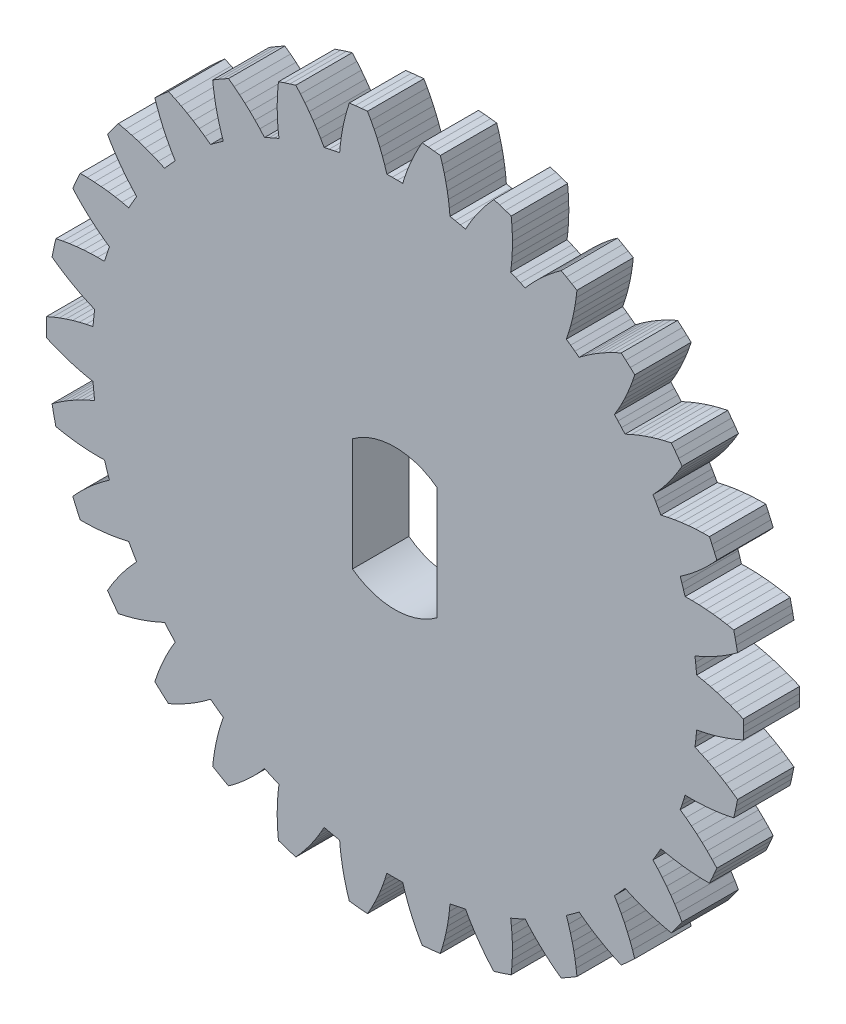
from build123d import *

# Parameters (mm, degrees)
BOSS_EXTRUDE1_DEPTH = 2
CUT_EXTRUDE1_REACH  = 33.235


with BuildPart() as part:
    # Sketch2 → Boss-Extrude1 (new body)
    with BuildSketch(Plane.XY):
        Polygon((0.281141132, 27.022846222), (0.355339468, 27.259799957), (0.437802315, 27.494007111), (0.528428257, 27.725175858), (0.627105772, 27.953025818), (0.733713448, 28.177274704), (0.848120153, 28.39764595), (0.970185101, 28.613870621), (1.185179591, 28.595060349), (1.399813175, 28.572502136), (1.614020228, 28.546201706), (1.688462257, 28.309322357), (1.754551053, 28.069980621), (1.812205195, 27.828466415), (1.861353755, 27.5850811), (1.901936412, 27.340120316), (1.933902979, 27.093887329), (1.957214355, 26.846683502), (2.141216993, 26.810916901), (2.324567318, 26.771945953), (2.507209539, 26.72977829), (2.629051915, 26.946127316), (2.758407156, 27.158071491), (2.895115389, 27.365346454), (3.039009235, 27.567701136), (3.189911242, 27.764884664), (3.347635644, 27.956653779), (3.511988817, 28.142774692), (3.718374287, 28.079675601), (3.923627496, 28.012985508), (4.127685444, 27.942723655), (4.15125075, 27.69554332), (4.166133402, 27.447691142), (4.172314036, 27.199467631), (4.169785929, 26.951182309), (4.158551547, 26.703136896), (4.138624851, 26.455638468), (4.110030253, 26.20898993), (4.282575697, 26.135748615), (4.453816861, 26.059508601), (4.623700762, 25.980288949), (4.787862081, 26.166577775), (4.958456272, 26.346995995), (5.135271989, 26.521318262), (5.318093314, 26.689333797), (5.506694511, 26.8508341), (5.700843297, 27.005619852), (5.900301673, 27.15350263), (6.089058086, 27.048872454), (6.27596037, 26.940965159), (6.460950902, 26.829812662), (6.432609568, 26.583134308), (6.395635633, 26.337604018), (6.350072635, 26.09351976), (6.295978353, 25.851185691), (6.233417927, 25.610896425), (6.162468861, 25.372949424), (6.083218008, 25.1376359), (6.236765195, 25.030120868), (6.388413139, 24.919943841), (6.538113977, 24.807134479), (6.737419602, 24.955221391), (6.941796958, 25.096228513), (7.150992465, 25.229979365), (7.364751099, 25.356312667), (7.582808708, 25.475071407), (7.804896645, 25.586108917), (8.030742935, 25.689290373), (8.193620731, 25.547701953), (8.354003563, 25.40329352), (8.511841705, 25.256108278), (8.432832383, 25.020712933), (8.3456178, 24.788235382), (8.250302492, 24.55895803), (8.147006213, 24.333166376), (8.035853936, 24.11113505), (7.916983314, 23.893138903), (7.79053985, 23.679444723), (7.91837803, 23.542354897), (8.04380501, 23.403056122), (8.16678014, 23.261587361), (8.39251946, 23.365000249), (8.621747709, 23.460433585), (8.854180158, 23.547767469), (9.089533824, 23.626897166), (9.327517681, 23.697724017), (9.567838461, 23.760160412), (9.810202098, 23.814131022), (9.940082735, 23.64177245), (10.066936617, 23.467174223), (10.190724084, 23.290388937), (10.064499861, 23.076564506), (9.930856325, 22.867300078), (9.789954444, 22.662850154), (9.641970712, 22.463469093), (9.48708447, 22.269399543), (9.325487508, 22.080881726), (9.157377619, 21.898146351), (9.253919651, 21.737473215), (9.347643907, 21.575140716), (9.438518726, 21.41119542), (9.680825848, 21.465414644), (9.924886617, 21.5111033), (10.170397595, 21.548203306), (10.417060207, 21.576671051), (10.664569277, 21.596470538), (10.912619727, 21.607577049), (11.160908258, 21.609978038), (11.25211533, 21.414382212), (11.339896137, 21.217224969), (11.424222823, 21.018566005), (11.256300304, 20.835657642), (11.082068678, 20.658752198), (10.901738311, 20.488065143), (10.715534726, 20.323808585), (10.523683791, 20.16618258), (10.326423053, 20.015382228), (10.123993948, 19.87159207), (10.185020481, 19.694357811), (10.242945813, 19.516086298), (10.297748656, 19.336829663), (10.546033596, 19.339485583), (10.794260257, 19.333432746), (11.042119756, 19.318677425), (11.289310975, 19.29523904), (11.535527923, 19.263145832), (11.780467049, 19.22243705), (12.023829074, 19.173163484), (12.072376393, 18.962878879), (12.117247684, 18.75177934), (12.158428108, 18.539929046), (11.956146312, 18.395930725), (11.748941355, 18.259115881), (11.537063805, 18.129651539), (11.320778356, 18.007698283), (11.100347536, 17.893404837), (10.876044262, 17.786912648), (10.648143063, 17.688352028), (10.670986946, 17.502302632), (10.690581739, 17.315883426), (10.706917458, 17.129149827), (10.950328974, 17.080126367), (11.19187283, 17.022596574), (11.431248201, 16.956630805), (11.668164585, 16.882310661), (11.902328548, 16.799727384), (12.133451335, 16.708982479), (12.361250766, 16.610187848), (12.365016582, 16.394404912), (12.365017264, 16.178589137), (12.361251645, 15.962806389), (12.133451257, 15.864011527), (11.90232882, 15.773266749), (11.668164153, 15.690683333), (11.431249552, 15.616363322), (11.191872731, 15.550397607), (10.95033005, 15.4928678), (10.706917134, 15.44384429), (10.690579979, 15.257111009), (10.670987846, 15.070691524), (10.648142492, 14.884642115), (10.876042332, 14.786081836), (11.100346759, 14.679589415), (11.320776149, 14.565296217), (11.537063315, 14.443342461), (11.748940205, 14.313878402), (11.956145478, 14.177063361), (12.158426386, 14.033065465), (12.117246114, 13.821214946), (12.07237616, 13.610115123), (12.023829072, 13.399830662), (11.780466062, 13.350557068), (11.535527305, 13.309848338), (11.28930964, 13.27775514), (11.042120192, 13.254316514), (10.794259285, 13.239561547), (10.546033773, 13.233508452), (10.297747452, 13.236164614), (10.24294327, 13.05690859), (10.185020482, 12.878636251), (10.123992507, 12.701402283), (10.326420355, 12.557612742), (10.523682173, 12.406811923), (10.71553176, 12.249186459), (10.90173692, 12.084929055), (11.082066701, 11.914242414), (11.256298594, 11.737336711), (11.424220333, 11.554428949), (11.33989375, 11.355769732), (11.25211419, 11.158611934), (11.160907375, 10.9630162), (10.912617874, 10.965417368), (10.664567796, 10.976523852), (10.417058027, 10.996323498), (10.170397097, 11.024790639), (9.924884815, 11.061891284), (9.680825117, 11.10757945), (9.438516695, 11.161799197), (9.347640693, 10.997854777), (9.253918754, 10.835520941), (9.157375372, 10.674848391), (9.325484159, 10.492113879), (9.48708208, 10.303595382), (9.641967116, 10.109526641), (9.789952212, 9.910144425), (9.930853606, 9.705695027), (10.064497351, 9.496430291), (10.190720935, 9.28260661), (10.066933516, 9.105821056), (9.940080739, 8.931222026), (9.810200372, 8.758863491), (9.567835824, 8.812834477), (9.327515403, 8.875270769), (9.089530894, 8.94609792), (8.854178748, 9.025226676), (8.621745157, 9.112561457), (8.392517852, 9.207994091), (8.16677737, 9.31140776), (8.043801265, 9.169940102), (7.918376273, 9.030639537), (7.790536894, 8.893550565), (7.916979459, 8.67985746), (8.035850878, 8.461860447), (8.147002145, 8.239830163), (8.250299518, 8.014037096), (8.345614459, 7.78476036), (8.432829182, 7.552282464), (8.511838035, 7.316887985), (8.353999884, 7.169702471), (8.193617966, 7.025293023), (8.030740441, 6.883704583), (7.804893339, 6.986886597), (7.582805731, 7.097923931), (7.364747547, 7.216683101), (7.150990204, 7.343015166), (6.941793767, 7.476767133), (6.737417189, 7.617773372), (6.538110588, 7.76586129), (6.388409027, 7.653053209), (6.236762655, 7.542874018), (6.083214474, 7.43536007), (6.16246467, 7.200047784), (6.233414336, 6.962099772), (6.29597399, 6.721811735), (6.350069049, 6.479476056), (6.395631815, 6.235392477), (6.432605816, 5.989861819), (6.460946871, 5.74318441), (6.275956274, 5.632031649), (6.089054672, 5.524123171), (5.900298521, 5.419492919), (5.700839466, 5.567376411), (5.506690965, 5.722161924), (5.318089296, 5.883662766), (5.135268977, 6.051676824), (4.958452581, 6.226000374), (4.787858967, 6.406417568), (4.623696903, 6.592707582), (4.453812561, 6.513489334), (4.282572485, 6.437246875), (4.110026293, 6.364006828), (4.138620508, 6.117359637), (4.158547579, 5.869860094), (4.169781462, 5.621816044), (4.172309994, 5.373528986), (4.166129275, 5.125306187), (4.15124661, 4.877453637), (4.127681228, 4.630274284), (3.923623161, 4.560012186), (3.718370374, 4.493320795), (3.511985145, 4.430221576), (3.347631456, 4.616343328), (3.189907283, 4.808112148), (3.039004926, 5.005296302), (2.895111756, 5.207649331), (2.758403127, 5.414925689), (2.629048237, 5.626868741), (2.50720538, 5.843219084), (2.324563018, 5.801052885), (2.14121325, 5.762079321), (1.957210144, 5.726314115), (1.933898672, 5.479111685), (1.901932241, 5.23287753), (1.861349379, 4.987918182), (1.812200874, 4.744531081), (1.754546797, 4.503017589), (1.688457911, 4.263675492), (1.614016012, 4.026797119), (1.399808792, 4.000496474), (1.185175351, 3.977936904), (0.970181069, 3.959126456), (0.848115791, 4.175352055), (0.733709249, 4.395722966), (0.627101361, 4.619972537), (0.528424163, 4.847820739), (0.437798123, 5.078990934), (0.355335386, 5.313196916), (0.281136853, 5.550152038), (0.09371882, 5.546880754), (-0.093727376, 5.546879417), (-0.281145577, 5.550152163), (-0.355343912, 5.313198427), (-0.437806759, 5.078991274), (-0.528432701, 4.847822527), (-0.627110217, 4.619972567), (-0.733717893, 4.395723681), (-0.848124598, 4.175352434), (-0.970189546, 3.959127764), (-1.185184036, 3.977938036), (-1.39981762, 4.000496248), (-1.614024673, 4.026796679), (-1.688466702, 4.263676027), (-1.754555498, 4.503017763), (-1.81220964, 4.744531969), (-1.8613582, 4.987917284), (-1.901940856, 5.232878069), (-1.933907423, 5.479111056), (-1.9572188, 5.726314882), (-2.141221438, 5.762081484), (-2.324571763, 5.801052431), (-2.507213984, 5.843220095), (-2.62905636, 5.626871069), (-2.758411601, 5.414926893), (-2.895119833, 5.207651931), (-3.039013679, 5.005297248), (-3.189915687, 4.80811372), (-3.347640089, 4.616344606), (-3.511993262, 4.430223693), (-3.718378731, 4.493322784), (-3.92363194, 4.560012876), (-4.127689888, 4.63027473), (-4.151255195, 4.877455064), (-4.166137847, 5.125307242), (-4.172318481, 5.373530754), (-4.169790374, 5.621816076), (-4.158555991, 5.869861488), (-4.138629296, 6.117359916), (-4.110034697, 6.364008454), (-4.282580141, 6.437249769), (-4.453821306, 6.513489784), (-4.623705206, 6.592709436), (-4.787866526, 6.406420609), (-4.958460716, 6.22600239), (-5.135276434, 6.051680122), (-5.318097758, 5.883664588), (-5.506698955, 5.722164285), (-5.700847742, 5.567378533), (-5.900306117, 5.419495754), (-6.08906253, 5.52412593), (-6.275964814, 5.632033226), (-6.460955346, 5.743185722), (-6.432614012, 5.989864076), (-6.395640077, 6.235394367), (-6.35007708, 6.479478625), (-6.295982797, 6.721812694), (-6.233422372, 6.96210196), (-6.162473306, 7.200048961), (-6.083222453, 7.435362485), (-6.23676964, 7.542877516), (-6.388417584, 7.653054544), (-6.538118421, 7.765863905), (-6.737424047, 7.617776994), (-6.941801402, 7.476769872), (-7.15099691, 7.343019019), (-7.364755543, 7.216685718), (-7.582813153, 7.097926978), (-7.80490109, 6.986889468), (-8.03074738, 6.883708011), (-8.193625175, 7.025296432), (-8.354008008, 7.169704864), (-8.511846149, 7.316890106), (-8.432836828, 7.552285452), (-8.345622244, 7.784763003), (-8.250306937, 8.014040355), (-8.147010658, 8.239832009), (-8.03585838, 8.461863334), (-7.916987758, 8.679859481), (-7.790544294, 8.893553662), (-7.918382474, 9.030643487), (-8.043809455, 9.169942263), (-8.166784585, 9.311411023), (-8.392523905, 9.207998136), (-8.621752154, 9.112564799), (-8.854184603, 9.025230915), (-9.089538268, 8.946101219), (-9.327522126, 8.875274368), (-9.567842905, 8.812837973), (-9.810206543, 8.758867363), (-9.94008718, 8.931225934), (-10.066941062, 9.105824162), (-10.190728528, 9.282609448), (-10.064504306, 9.496433879), (-9.930860769, 9.705698306), (-9.789958888, 9.910148231), (-9.641975156, 10.109529292), (-9.487088914, 10.303598842), (-9.325491953, 10.492116658), (-9.157382064, 10.674852034), (-9.253924095, 10.83552517), (-9.347648352, 10.997857668), (-9.438523171, 11.161802965), (-9.680830293, 11.10758374), (-9.924891061, 11.061895084), (-10.170402039, 11.024795079), (-10.417064651, 10.996327334), (-10.664573721, 10.976527846), (-10.912624171, 10.965421336), (-11.160912703, 10.963020347), (-11.252119774, 11.158616173), (-11.339900581, 11.355773415), (-11.424227267, 11.55443238), (-11.256304748, 11.737340743), (-11.082073123, 11.914246187), (-10.901742756, 12.084933241), (-10.71553917, 12.2491898), (-10.523688236, 12.406815804), (-10.326427498, 12.557616157), (-10.123998392, 12.701406314), (-10.185024926, 12.878640574), (-10.242950258, 13.056912087), (-10.2977531, 13.236168722), (-10.546038041, 13.233512801), (-10.794264702, 13.239565639), (-11.042124201, 13.25432096), (-11.28931542, 13.277759345), (-11.535532368, 13.309852552), (-11.780471494, 13.350561334), (-12.023833519, 13.399834901), (-12.072380838, 13.610119505), (-12.117252128, 13.821219045), (-12.158432552, 14.033069339), (-11.956150756, 14.17706766), (-11.7489458, 14.313882504), (-11.53706825, 14.443346845), (-11.3207828, 14.565300102), (-11.10035198, 14.679593547), (-10.876048707, 14.786085737), (-10.648147508, 14.884646357), (-10.67099139, 15.070695752), (-10.690586183, 15.257114958), (-10.706921902, 15.443848558), (-10.950333418, 15.492872017), (-11.191877275, 15.550401811), (-11.431252646, 15.61636758), (-11.668169029, 15.690687724), (-11.902332993, 15.773271), (-12.13345578, 15.864015905), (-12.36125521, 15.962810536), (-12.365021026, 16.178593473), (-12.365021709, 16.394409247), (-12.361256089, 16.610191995), (-12.133455701, 16.708986857), (-11.902333265, 16.799731636), (-11.668168598, 16.882315051), (-11.431253996, 16.956635063), (-11.191877175, 17.022600778), (-10.950334495, 17.080130585), (-10.706921579, 17.129154095), (-10.690584423, 17.315887375), (-10.670992291, 17.502306861), (-10.648146937, 17.68835627), (-10.876046777, 17.786916549), (-11.100351204, 17.89340897), (-11.320780594, 18.007702167), (-11.537067759, 18.129655924), (-11.74894465, 18.259119983), (-11.956149923, 18.395935023), (-12.15843083, 18.53993292), (-12.117250559, 18.751783439), (-12.072380604, 18.962883262), (-12.023833516, 19.173167723), (-11.780470507, 19.222441316), (-11.53553175, 19.263150047), (-11.289314085, 19.295243245), (-11.042124637, 19.318681871), (-10.79426373, 19.333436837), (-10.546038217, 19.339489932), (-10.297751896, 19.336833771), (-10.242947715, 19.516089795), (-10.185024927, 19.694362134), (-10.123996952, 19.871596101), (-10.326424799, 20.015385643), (-10.523686617, 20.166186461), (-10.715536204, 20.323811925), (-10.901741364, 20.48806933), (-11.082071145, 20.658755971), (-11.256303039, 20.835661674), (-11.424224777, 21.018569436), (-11.339898194, 21.217228653), (-11.252118634, 21.41438645), (-11.160911819, 21.609982184), (-10.912622319, 21.607581017), (-10.66457224, 21.596474532), (-10.417062471, 21.576674886), (-10.170401541, 21.548207746), (-9.92488926, 21.5111071), (-9.680829561, 21.465418935), (-9.438521139, 21.411199188), (-9.347645138, 21.575143608), (-9.253923198, 21.737477444), (-9.157379817, 21.898149994), (-9.325488603, 22.080884505), (-9.487086524, 22.269403002), (-9.641971561, 22.463471744), (-9.789956657, 22.66285396), (-9.930858051, 22.867303358), (-10.064501796, 23.076568094), (-10.19072538, 23.290391775), (-10.066937961, 23.467177329), (-9.940085184, 23.641776359), (-9.810204817, 23.814134894), (-9.567840268, 23.760163908), (-9.327519847, 23.697727616), (-9.089535338, 23.626900465), (-8.854183193, 23.547771708), (-8.621749602, 23.460436928), (-8.392522297, 23.365004293), (-8.166781814, 23.261590624), (-8.04380571, 23.403058282), (-7.918380717, 23.542358848), (-7.790541339, 23.679447819), (-7.916983904, 23.893140925), (-8.035855323, 24.111137938), (-8.14700659, 24.333168221), (-8.250303963, 24.558961289), (-8.345618903, 24.788238024), (-8.432833627, 25.020715921), (-8.511842479, 25.2561104), (-8.354004329, 25.403295914), (-8.19362241, 25.547705361), (-8.030744886, 25.689293801), (-7.804897784, 25.586111788), (-7.582810175, 25.475074454), (-7.364751992, 25.356315284), (-7.150994649, 25.229983218), (-6.941798211, 25.096231251), (-6.737421633, 24.955225013), (-6.538115033, 24.807137095), (-6.388413471, 24.919945175), (-6.2367671, 25.030124367), (-6.083218918, 25.137638314), (-6.162469115, 25.3729506), (-6.233418781, 25.610898613), (-6.295978434, 25.85118665), (-6.350073493, 26.093522329), (-6.39563626, 26.337605908), (-6.43261026, 26.583136565), (-6.460951315, 26.829813974), (-6.275960718, 26.940966735), (-6.089059117, 27.048875213), (-5.900302965, 27.153505465), (-5.700843911, 27.005621973), (-5.50669541, 26.850836461), (-5.31809374, 26.689335619), (-5.135273422, 26.521321561), (-4.958457026, 26.34699801), (-4.787863412, 26.166580816), (-4.623701348, 25.980290803), (-4.453817006, 26.059509051), (-4.282576929, 26.135751509), (-4.110030738, 26.208991557), (-4.138624952, 26.455638748), (-4.158552024, 26.70313829), (-4.169785907, 26.95118234), (-4.172314438, 27.199469398), (-4.16613372, 27.447692198), (-4.151251055, 27.695544748), (-4.127685673, 27.9427241), (-3.923627606, 28.012986199), (-3.718374819, 28.07967759), (-3.511989589, 28.142776809), (-3.347635901, 27.956655057), (-3.189911728, 27.764886236), (-3.03900937, 27.567702083), (-2.895116201, 27.365349054), (-2.758407572, 27.158072695), (-2.629052681, 26.946129643), (-2.507209825, 26.729779301), (-2.324567463, 26.7719455), (-2.141217695, 26.810919064), (-1.957214589, 26.84668427), (-1.933903117, 27.093886699), (-1.901936686, 27.340120854), (-1.861353823, 27.585080202), (-1.812205318, 27.828467304), (-1.754551241, 28.069980796), (-1.688462356, 28.309322893), (-1.614020457, 28.546201265), (-1.399813237, 28.57250191), (-1.185179795, 28.595061481), (-0.970185513, 28.613871928), (-0.848120235, 28.39764633), (-0.733713693, 28.177275419), (-0.627105805, 27.953025848), (-0.528428607, 27.725177646), (-0.437802568, 27.494007451), (-0.355339831, 27.259801469), (-0.281141298, 27.022846346), (-0.093723264, 27.02611763), (0.093722931, 27.026118968), align=None)
    extrude(amount=BOSS_EXTRUDE1_DEPTH)

    # Sketch3 → Cut-Extrude1 (cut, up to next)
    with BuildSketch(Plane.XY.offset(2), mode=Mode.PRIVATE) as cut_extrude1_sk1:
        with BuildLine():
            Line((-1.5, 18.286500859), (-1.5, 14.286497526))
            ThreePointArc((-1.5, 14.286497526), (-4.44e-07, 13.786499192), (1.5, 14.286497526))
            Line((1.5, 14.286497526), (1.5, 18.286500859))
            ThreePointArc((1.5, 18.286500859), (-4.44e-07, 18.786501859), (-1.5, 18.286500859))
        make_face()
    cut_extrude1_tool1 = extrude(cut_extrude1_sk1.sketch, amount=-CUT_EXTRUDE1_REACH, mode=Mode.PRIVATE) & part.part
    add(cut_extrude1_tool1.solids().sort_by_distance((0, 16.2865, 2))[0], mode=Mode.SUBTRACT)


solid = part.part
